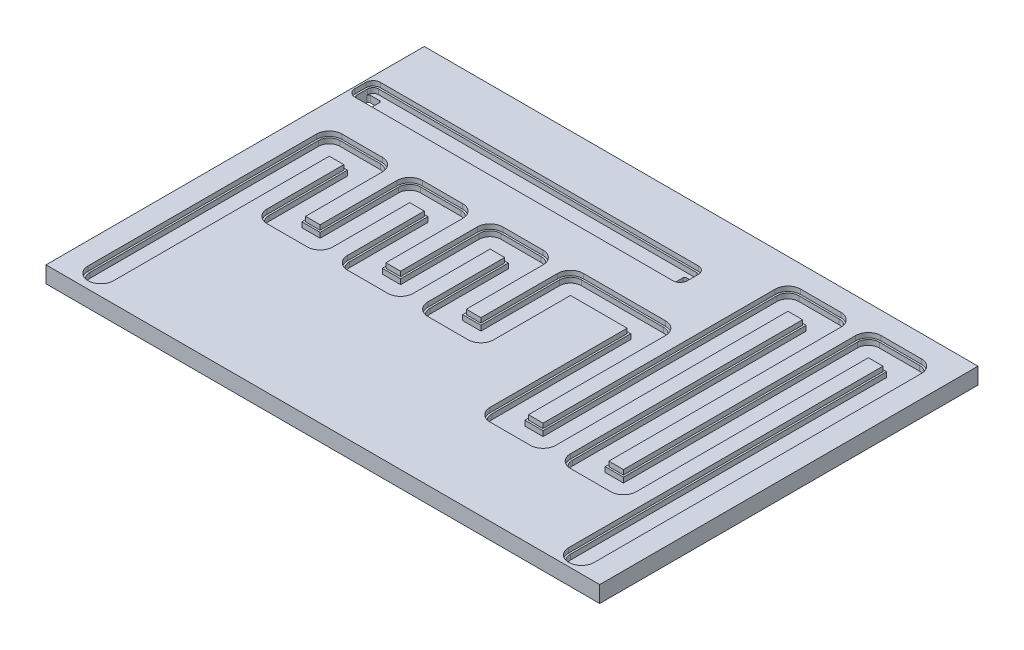
from build123d import *

# Parameters (mm, degrees)
SKETCH_1_W          = 1515
SKETCH_1_H          = 1035
EXTRUDE_1_DEPTH     = 45
CUT_EXTRUDE_1_DEPTH = 13
CUT_EXTRUDE_2_DEPTH = 27
CUT_EXTRUDE_3_DEPTH = 45
CUT_EXTRUDE_5_DEPTH = 13
CUT_EXTRUDE_6_DEPTH = 27
SKETCH_3_R          = 10.25
CUT_EXTRUDE_7_DEPTH = 45


with BuildPart() as part:
    # 草图1 → 凸台-拉伸1 (new body)
    with BuildSketch(Plane(origin=(0, 0, 0), x_dir=(1, 0, 0), z_dir=(0, 1, 0))):
        with Locations((757.5, -517.5)):
            Rectangle(SKETCH_1_W, SKETCH_1_H)
    extrude(amount=-EXTRUDE_1_DEPTH)

    # 草图1<3> → 切除-拉伸1 (cut)
    with BuildSketch(Plane(origin=(0, 0, 0), x_dir=(1, 0, 0), z_dir=(0, 1, 0))):
        with BuildLine():
            Line((5, -195), (5, -165))
            ThreePointArc((5, -165), (10.857864376, -150.857864376), (25, -145))
            Line((25, -145), (895, -145))
            ThreePointArc((895, -145), (909.142135624, -150.857864376), (915, -165))
            Line((915, -165), (915, -195))
            ThreePointArc((915, -195), (909.142135624, -209.142135624), (895, -215))
            Line((895, -215), (25, -215))
            ThreePointArc((25, -215), (10.857864376, -209.142135624), (5, -195))
        make_face()
    extrude(amount=-CUT_EXTRUDE_1_DEPTH, mode=Mode.SUBTRACT)

    # 草图1<5> → 切除-拉伸2 (cut)
    with BuildSketch(Plane(origin=(0, 0, 0), x_dir=(1, 0, 0), z_dir=(0, 1, 0))):
        with BuildLine():
            Line((25, -150), (895, -150))
            ThreePointArc((895, -150), (905.606601718, -154.393398282), (910, -165))
            Line((910, -165), (910, -195))
            ThreePointArc((910, -195), (905.606601718, -205.606601718), (895, -210))
            Line((895, -210), (25, -210))
            ThreePointArc((25, -210), (14.393398282, -205.606601718), (10, -195))
            Line((10, -195), (10, -165))
            ThreePointArc((10, -165), (14.393398282, -154.393398282), (25, -150))
        make_face()
    extrude(amount=-CUT_EXTRUDE_2_DEPTH, mode=Mode.SUBTRACT)

    # 草图1<6> → 切除-拉伸3 (cut)
    with BuildSketch(Plane(origin=(0, 0, 0), x_dir=(1, 0, 0), z_dir=(0, 1, 0))):
        with BuildLine():
            Line((40, -197.5), (15, -197.5))
            ThreePointArc((15, -197.5), (11.464466094, -196.035533906), (10, -192.5))
            Line((10, -192.5), (10, -167.5))
            ThreePointArc((10, -167.5), (11.464466094, -163.964466094), (15, -162.5))
            Line((15, -162.5), (40, -162.5))
            ThreePointArc((40, -162.5), (43.535533906, -163.964466094), (45, -167.5))
            Line((45, -167.5), (45, -192.5))
            ThreePointArc((45, -192.5), (43.535533906, -196.035533906), (40, -197.5))
        make_face()
        with BuildLine():
            Line((905, -197.5), (880, -197.5))
            ThreePointArc((880, -197.5), (876.464466094, -196.035533906), (875, -192.5))
            Line((875, -192.5), (875, -167.5))
            ThreePointArc((875, -167.5), (876.464466094, -163.964466094), (880, -162.5))
            Line((880, -162.5), (905, -162.5))
            ThreePointArc((905, -162.5), (908.535533906, -163.964466094), (910, -167.5))
            Line((910, -167.5), (910, -192.5))
            ThreePointArc((910, -192.5), (908.535533906, -196.035533906), (905, -197.5))
        make_face()
    extrude(amount=-CUT_EXTRUDE_3_DEPTH, mode=Mode.SUBTRACT)

    # 草图1<9> → 切除-拉伸5 (cut)
    with BuildSketch(Plane(origin=(0, 0, 0), x_dir=(1, 0, 0), z_dir=(0, 1, 0))):
        with BuildLine():
            Line((60, -980), (60, -355))
            ThreePointArc((60, -355), (70.251262658, -330.251262658), (95, -320))
            Line((95, -320), (205, -320))
            ThreePointArc((205, -320), (229.748737342, -330.251262658), (240, -355))
            Line((240, -355), (240, -565))
            Line((240, -565), (280, -565))
            Line((280, -565), (280, -355))
            ThreePointArc((280, -355), (290.251262658, -330.251262658), (315, -320))
            Line((315, -320), (425, -320))
            ThreePointArc((425, -320), (449.748737342, -330.251262658), (460, -355))
            Line((460, -355), (460, -565))
            Line((460, -565), (500, -565))
            Line((500, -565), (500, -355))
            ThreePointArc((500, -355), (510.251262658, -330.251262658), (535, -320))
            Line((535, -320), (645, -320))
            ThreePointArc((645, -320), (669.748737342, -330.251262658), (680, -355))
            Line((680, -355), (680, -565))
            Line((680, -565), (720, -565))
            Line((720, -565), (720, -355))
            ThreePointArc((720, -355), (730.251262658, -330.251262658), (755, -320))
            Line((755, -320), (980, -320))
            ThreePointArc((980, -320), (1004.748737342, -330.251262658), (1015, -355))
            Line((1015, -355), (1015, -730))
            Line((1015, -730), (1055, -730))
            Line((1055, -730), (1055, -95))
            ThreePointArc((1055, -95), (1065.251262658, -70.251262658), (1090, -60))
            Line((1090, -60), (1200, -60))
            ThreePointArc((1200, -60), (1224.748737342, -70.251262658), (1235, -95))
            Line((1235, -95), (1235, -730))
            Line((1235, -730), (1275, -730))
            Line((1275, -730), (1275, -95))
            ThreePointArc((1275, -95), (1285.251262658, -70.251262658), (1310, -60))
            Line((1310, -60), (1420, -60))
            ThreePointArc((1420, -60), (1444.748737342, -70.251262658), (1455, -95))
            Line((1455, -95), (1455, -990))
            ThreePointArc((1455, -990), (1420, -1025), (1385, -990))
            Line((1385, -990), (1385, -130))
            Line((1385, -130), (1345, -130))
            Line((1345, -130), (1345, -765))
            ThreePointArc((1345, -765), (1334.748737342, -789.748737342), (1310, -800))
            Line((1310, -800), (1200, -800))
            ThreePointArc((1200, -800), (1175.251262658, -789.748737342), (1165, -765))
            Line((1165, -765), (1165, -130))
            Line((1165, -130), (1125, -130))
            Line((1125, -130), (1125, -765))
            ThreePointArc((1125, -765), (1114.748737342, -789.748737342), (1090, -800))
            Line((1090, -800), (980, -800))
            ThreePointArc((980, -800), (955.251262658, -789.748737342), (945, -765))
            Line((945, -765), (945, -390))
            Line((945, -390), (790, -390))
            Line((790, -390), (790, -600))
            ThreePointArc((790, -600), (779.748737342, -624.748737342), (755, -635))
            Line((755, -635), (645, -635))
            ThreePointArc((645, -635), (620.251262658, -624.748737342), (610, -600))
            Line((610, -600), (610, -390))
            Line((610, -390), (570, -390))
            Line((570, -390), (570, -600))
            ThreePointArc((570, -600), (559.748737342, -624.748737342), (535, -635))
            Line((535, -635), (425, -635))
            ThreePointArc((425, -635), (400.251262658, -624.748737342), (390, -600))
            Line((390, -600), (390, -390))
            Line((390, -390), (350, -390))
            Line((350, -390), (350, -600))
            ThreePointArc((350, -600), (339.748737342, -624.748737342), (315, -635))
            Line((315, -635), (205, -635))
            ThreePointArc((205, -635), (180.251262658, -624.748737342), (170, -600))
            Line((170, -600), (170, -390))
            Line((170, -390), (130, -390))
            Line((130, -390), (130, -980))
            ThreePointArc((130, -980), (95, -1015), (60, -980))
        make_face()
    extrude(amount=-CUT_EXTRUDE_5_DEPTH, mode=Mode.SUBTRACT)

    # 草图1<10> → 切除-拉伸6 (cut)
    with BuildSketch(Plane(origin=(0, 0, 0), x_dir=(1, 0, 0), z_dir=(0, 1, 0))):
        with BuildLine():
            Line((1390, -990), (1390, -125))
            Line((1390, -125), (1340, -125))
            Line((1340, -125), (1340, -765))
            ThreePointArc((1340, -765), (1331.213203436, -786.213203436), (1310, -795))
            Line((1310, -795), (1200, -795))
            ThreePointArc((1200, -795), (1178.786796564, -786.213203436), (1170, -765))
            Line((1170, -765), (1170, -125))
            Line((1170, -125), (1120, -125))
            Line((1120, -125), (1120, -765))
            ThreePointArc((1120, -765), (1111.213203436, -786.213203436), (1090, -795))
            Line((1090, -795), (980, -795))
            ThreePointArc((980, -795), (958.786796564, -786.213203436), (950, -765))
            Line((950, -765), (950, -385))
            Line((950, -385), (785, -385))
            Line((785, -385), (785, -600))
            ThreePointArc((785, -600), (776.213203436, -621.213203436), (755, -630))
            Line((755, -630), (645, -630))
            ThreePointArc((645, -630), (623.786796564, -621.213203436), (615, -600))
            Line((615, -600), (615, -385))
            Line((615, -385), (565, -385))
            Line((565, -385), (565, -600))
            ThreePointArc((565, -600), (556.213203436, -621.213203436), (535, -630))
            Line((535, -630), (425, -630))
            ThreePointArc((425, -630), (403.786796564, -621.213203436), (395, -600))
            Line((395, -600), (395, -385))
            Line((395, -385), (345, -385))
            Line((345, -385), (345, -600))
            ThreePointArc((345, -600), (336.213203436, -621.213203436), (315, -630))
            Line((315, -630), (205, -630))
            ThreePointArc((205, -630), (183.786796564, -621.213203436), (175, -600))
            Line((175, -600), (175, -385))
            Line((175, -385), (125, -385))
            Line((125, -385), (125, -980))
            ThreePointArc((125, -980), (95, -1010), (65, -980))
            Line((65, -980), (65, -355))
            ThreePointArc((65, -355), (73.786796564, -333.786796564), (95, -325))
            Line((95, -325), (205, -325))
            ThreePointArc((205, -325), (226.213203436, -333.786796564), (235, -355))
            Line((235, -355), (235, -570))
            Line((235, -570), (285, -570))
            Line((285, -570), (285, -355))
            ThreePointArc((285, -355), (293.786796564, -333.786796564), (315, -325))
            Line((315, -325), (425, -325))
            ThreePointArc((425, -325), (446.213203436, -333.786796564), (455, -355))
            Line((455, -355), (455, -570))
            Line((455, -570), (505, -570))
            Line((505, -570), (505, -355))
            ThreePointArc((505, -355), (513.786796564, -333.786796564), (535, -325))
            Line((535, -325), (645, -325))
            ThreePointArc((645, -325), (666.213203436, -333.786796564), (675, -355))
            Line((675, -355), (675, -570))
            Line((675, -570), (725, -570))
            Line((725, -570), (725, -355))
            ThreePointArc((725, -355), (733.786796564, -333.786796564), (755, -325))
            Line((755, -325), (980, -325))
            ThreePointArc((980, -325), (1001.213203436, -333.786796564), (1010, -355))
            Line((1010, -355), (1010, -735))
            Line((1010, -735), (1060, -735))
            Line((1060, -735), (1060, -95))
            ThreePointArc((1060, -95), (1068.786796564, -73.786796564), (1090, -65))
            Line((1090, -65), (1200, -65))
            ThreePointArc((1200, -65), (1221.213203436, -73.786796564), (1230, -95))
            Line((1230, -95), (1230, -735))
            Line((1230, -735), (1280, -735))
            Line((1280, -735), (1280, -95))
            ThreePointArc((1280, -95), (1288.786796564, -73.786796564), (1310, -65))
            Line((1310, -65), (1420, -65))
            ThreePointArc((1420, -65), (1441.213203436, -73.786796564), (1450, -95))
            Line((1450, -95), (1450, -990))
            ThreePointArc((1450, -990), (1420, -1020), (1390, -990))
        make_face()
    extrude(amount=-CUT_EXTRUDE_6_DEPTH, mode=Mode.SUBTRACT)

    # 草图3 → 切除-拉伸7 (cut)
    with BuildSketch(Plane(origin=(0, 0, 0), x_dir=(1, 0, 0), z_dir=(0, 1, 0))):
        with Locations((95, -990)):
            Circle(SKETCH_3_R)
        with Locations((1420, -1007.5)):
            Circle(SKETCH_3_R)
    extrude(amount=-CUT_EXTRUDE_7_DEPTH, mode=Mode.SUBTRACT)


solid = part.part
